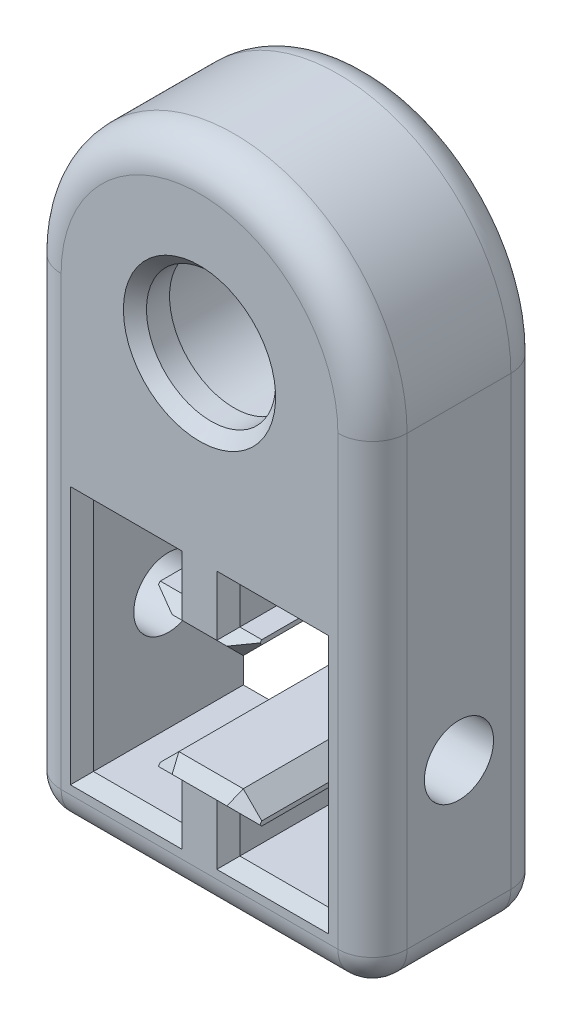
from build123d import *

# Parameters (mm, degrees)
BOSS_EXTRUDE1_DEPTH = 15
SKETCH4_R           = 6.8
BOSS_EXTRUDE2_DEPTH = 15
SKETCH3_R           = 3
CUT_EXTRUDE1_DEPTH  = 54.593283161
FILLET1_R           = 3
SKETCH5_R           = 10
SKETCH5_R_2         = 5.6
BOSS_EXTRUDE3_DEPTH = 3
CHAMFER1_SIZE       = 1


with BuildPart() as part:
    # Sketch1 → Boss-Extrude1 (new body)
    with BuildSketch(Plane.XY):
        Polygon((0, 15), (15, 15), (15, -14.949649214), (-15, -14.949649214), (-15, 15), align=None)
        Polygon((-10.2, 10.2), (-2.5, 10.2), (-2.5, 7), (-4.4, 7), (-4.4, 6.61), (-2.79, 5), (2.79, 5), (4.4, 6.61), (4.4, 7), (2.5, 7), (2.5, 10.2), (10.2, 10.2), (10.2, 3), (10.2, -3), (10.2, -10.2), (2.5, -10.2), (2.5, -7), (4.4, -7), (4.4, -6.61), (2.79, -5), (-2.79, -5), (-4.4, -6.61), (-4.4, -7), (-2.5, -7), (-2.5, -10.2), (-10.2, -10.2), (-10.2, -3), (-10.2, 3), align=None, mode=Mode.SUBTRACT)
    extrude(amount=BOSS_EXTRUDE1_DEPTH)

    # Sketch4 → Boss-Extrude2 (add)
    with BuildSketch(Plane(origin=(0, 0, 0), x_dir=(-1, 0, 0), z_dir=(0, 0, -1))):
        with BuildLine():
            ThreePointArc((-15, 26.8), (0, 41.8), (15, 26.8))
            Line((15, 26.8), (15, 15))
            Line((15, 15), (-15, 15))
            Line((-15, 15), (-15, 26.8))
        make_face()
        with Locations((0, 26.8)):
            Circle(SKETCH4_R, mode=Mode.SUBTRACT)
    extrude(amount=-BOSS_EXTRUDE2_DEPTH)

    # Sketch3 → Cut-Extrude1 (cut, through all)
    with BuildSketch(Plane.ZY.offset(15)):
        with Locations((7.5, 0)):
            Circle(SKETCH3_R)
    extrude(amount=-CUT_EXTRUDE1_DEPTH, mode=Mode.SUBTRACT)

    # Fillet1
    fillet1_edges = [part.edges().sort_by_distance(p)[0] for p in [
        (0, -14.949649214, 15),
        (15, 5.925175393, 15),
        (15, 5.925175393, 0),
        (0, -14.949649214, 0),
        (-15, 5.925175393, 0),
        (-15, 5.925175393, 15),
        (15, -14.949649214, 7.5),
        (-15, -14.949649214, 7.5),
        (0, 41.8, 15),
        (0, 41.8, 0),
    ]]
    fillet(fillet1_edges, radius=FILLET1_R)

    # Sketch5 → Boss-Extrude3 (add)
    with BuildSketch(Plane.XY.offset(15)):
        with Locations((0, 26.8)):
            Circle(SKETCH5_R)
        with Locations((0, 26.8)):
            Circle(SKETCH5_R_2, mode=Mode.SUBTRACT)
    extrude(amount=-BOSS_EXTRUDE3_DEPTH)

    # Chamfer1
    # the kernel refuses this chamfer: 1 mm, written as the material it takes off along each edge
    with BuildSketch(Plane(origin=(0, 26.8, 0), x_dir=(-1, 0, 0), z_dir=(0, -1, 0))) as chamfer1_piece_1:
        Polygon((6.8 + CHAMFER1_SIZE, 0), (6.8, -CHAMFER1_SIZE), (6.8, 0), align=None)
    revolve(axis=Axis((0, 26.8, 0), (0, 0, -1)), mode=Mode.SUBTRACT)
    with BuildSketch(Plane(origin=(-6.21845448, 8.42845448, 0), x_dir=(-0.019442520806012907, -0.01944252080601295, 0.9996219169112968), z_dir=(0.7071067811865483, -0.7071067811865468, 0)), Plane(origin=(0.97154552, 3.18154552, 0), x_dir=(0.019442520806014205, -0.019442520806014246, 0.9996219169112968), z_dir=(0.7071067811865483, 0.7071067811865468, 0)), Plane(origin=(6.21845448, -8.42845448, 0), x_dir=(0.019442520806012883, 0.01944252080601297, 0.9996219169112968), z_dir=(-0.7071067811865491, 0.707106781186546, 0)), Plane(origin=(-0.97154552, -3.18154552, 0), x_dir=(-0.01944252080601413, 0.019442520806014215, 0.9996219169112968), z_dir=(-0.7071067811865491, -0.707106781186546, 0)), Plane(origin=(-0.97154552, -3.18154552, 15), x_dir=(0.7068394360706718, -0.7068394360706751, 0.027495876610585623), z_dir=(-0.7071067811865491, -0.707106781186546, 0)), Plane(origin=(6.21845448, -8.42845448, 15), x_dir=(-0.706839436070672, -0.706839436070675, 0.02749587661058563), z_dir=(-0.7071067811865491, 0.707106781186546, 0)), Plane(origin=(0.97154552, 3.18154552, 15), x_dir=(-0.7068394360706727, 0.7068394360706742, 0.027495876610585623), z_dir=(0.7071067811865483, 0.7071067811865468, 0)), Plane(origin=(-6.21845448, 8.42845448, 15), x_dir=(0.7068394360706728, 0.7068394360706743, 0.027495876610585647), z_dir=(0.7071067811865483, -0.7071067811865468, 0))) as chamfer1_piece_2:
        Polygon((CHAMFER1_SIZE * 0.999621916911, -CHAMFER1_SIZE * 0.0274958766106), (-CHAMFER1_SIZE * 0.0274958766106, -CHAMFER1_SIZE * 0.999621916911), (0, 0), align=None)
    extrude(amount=7.420249811, mode=Mode.SUBTRACT)
    with BuildSketch(Plane(origin=(-5.361682988, 5, 0), x_dir=(0, -0.027495876610586494, 0.9996219169112968), z_dir=(1, 0, 0)), Plane(origin=(5.361682988, -5, 0), x_dir=(0, 0.027495876610586494, 0.9996219169112968), z_dir=(-1, 0, 0)), Plane(origin=(5.361682988, -5, 15), x_dir=(0, -0.9996219169112968, 0.027495876610585623), z_dir=(-1, 0, 0)), Plane(origin=(-5.361682988, 5, 15), x_dir=(0, 0.9996219169112968, 0.027495876610585623), z_dir=(1, 0, 0))) as chamfer1_piece_3:
        Polygon((CHAMFER1_SIZE * 0.999621916911, -CHAMFER1_SIZE * 0.0274958766106), (-CHAMFER1_SIZE * 0.0274958766106, -CHAMFER1_SIZE * 0.999621916911), (0, 0), align=None)
    extrude(amount=10.723365976, mode=Mode.SUBTRACT)
    with BuildSketch(Plane(origin=(6.971682988, 7, 0), x_dir=(0, 0.027495876610586494, 0.9996219169112968), z_dir=(-1, 0, 0)), Plane(origin=(2.5, -7, 0), x_dir=(0, -0.027495876610586494, 0.9996219169112968), z_dir=(1, 0, 0)), Plane(origin=(-6.971682988, -7, 0), x_dir=(0, -0.027495876610586494, 0.9996219169112968), z_dir=(1, 0, 0)), Plane(origin=(-2.5, 7, 0), x_dir=(0, 0.027495876610586494, 0.9996219169112968), z_dir=(-1, 0, 0)), Plane(origin=(-6.971682988, -7, 15), x_dir=(0, 0.9996219169112968, 0.027495876610585623), z_dir=(1, 0, 0)), Plane(origin=(2.5, -7, 15), x_dir=(0, 0.9996219169112968, 0.027495876610585623), z_dir=(1, 0, 0)), Plane(origin=(6.971682988, 7, 15), x_dir=(0, -0.9996219169112968, 0.027495876610585623), z_dir=(-1, 0, 0)), Plane(origin=(-2.5, 7, 15), x_dir=(0, -0.9996219169112968, 0.027495876610585623), z_dir=(-1, 0, 0))) as chamfer1_piece_4:
        Polygon((CHAMFER1_SIZE * 0.999621916911, -CHAMFER1_SIZE * 0.0274958766106), (-CHAMFER1_SIZE * 0.0274958766106, -CHAMFER1_SIZE * 0.999621916911), (0, 0), align=None)
    extrude(amount=4.471682988, mode=Mode.SUBTRACT)
    with BuildSketch(Plane(origin=(2.5, 7, 0), x_dir=(0.027495876610586494, 0, 0.9996219169112968), z_dir=(0, 1, 0)), Plane(origin=(2.5, -10.2, 0), x_dir=(0.027495876610586494, 0, 0.9996219169112968), z_dir=(0, 1, 0)), Plane(origin=(-2.5, -7, 0), x_dir=(-0.027495876610586494, 0, 0.9996219169112968), z_dir=(0, -1, 0)), Plane(origin=(-2.5, 10.2, 0), x_dir=(-0.027495876610586494, 0, 0.9996219169112968), z_dir=(0, -1, 0)), Plane(origin=(-2.5, 10.2, 15), x_dir=(0.9996219169112968, 3.884311438261996e-15, 0.02749587661058563), z_dir=(0, -1, 0)), Plane(origin=(-2.5, -7, 15), x_dir=(0.9996219169112968, -4.161762255280711e-15, 0.02749587661058563), z_dir=(0, -1, 0)), Plane(origin=(2.5, -10.2, 15), x_dir=(-0.9996219169112968, -4.161762255280711e-15, 0.02749587661058563), z_dir=(0, 1, 0)), Plane(origin=(2.5, 7, 15), x_dir=(-0.9996219169112968, 3.606860621243281e-15, 0.02749587661058563), z_dir=(0, 1, 0))) as chamfer1_piece_5:
        Polygon((CHAMFER1_SIZE * 0.999621916911, -CHAMFER1_SIZE * 0.0274958766106), (-CHAMFER1_SIZE * 0.0274958766106, -CHAMFER1_SIZE * 0.999621916911), (0, 0), align=None)
    extrude(amount=3.2, mode=Mode.SUBTRACT)
    with BuildSketch(Plane(origin=(2.5, 10.2, 0), x_dir=(0, -0.02749587661058563, 0.9996219169112968), z_dir=(1, 0, 0)), Plane(origin=(10.2, -10.2, 0), x_dir=(0, 0.02749587661058563, 0.9996219169112968), z_dir=(-1, 0, 0)), Plane(origin=(-2.5, -10.2, 0), x_dir=(0, 0.02749587661058563, 0.9996219169112968), z_dir=(-1, 0, 0)), Plane(origin=(-10.2, 10.2, 0), x_dir=(0, -0.02749587661058563, 0.9996219169112968), z_dir=(1, 0, 0)), Plane(origin=(-10.2, 10.2, 15), x_dir=(0, 0.9996219169112968, 0.027495876610585647), z_dir=(1, 0, 0)), Plane(origin=(-2.5, -10.2, 15), x_dir=(0, -0.9996219169112968, 0.027495876610585647), z_dir=(-1, 0, 0)), Plane(origin=(10.2, -10.2, 15), x_dir=(0, -0.9996219169112968, 0.027495876610585647), z_dir=(-1, 0, 0)), Plane(origin=(2.5, 10.2, 15), x_dir=(0, 0.9996219169112968, 0.027495876610585647), z_dir=(1, 0, 0))) as chamfer1_piece_6:
        Polygon((CHAMFER1_SIZE * 0.999621916911, -CHAMFER1_SIZE * 0.0274958766106), (-CHAMFER1_SIZE * 0.0274958766106, -CHAMFER1_SIZE * 0.999621916911), (0, 0), align=None)
    extrude(amount=7.7, mode=Mode.SUBTRACT)
    with BuildSketch(Plane(origin=(10.2, 10.2, 0), x_dir=(-0.027495876610583895, 0, 0.9996219169112968), z_dir=(0, -1, 0)), Plane(origin=(-10.2, -10.2, 0), x_dir=(0.02749587661058217, 0, 0.9996219169112968), z_dir=(0, 1, 0))) as chamfer1_piece_7:
        Polygon((CHAMFER1_SIZE * 0.999621916911, -CHAMFER1_SIZE * 0.0274958766106), (-CHAMFER1_SIZE * 0.0274958766106, -CHAMFER1_SIZE * 0.999621916911), (0, 0), align=None)
    extrude(amount=20.4, mode=Mode.SUBTRACT)
    with BuildSketch(Plane(origin=(-10.2, 10.2, 15), x_dir=(-0.9996219169112968, 0, 0.027495876610585647), z_dir=(0, -1, 0)), Plane(origin=(10.2, -10.2, 15), x_dir=(0.9996219169112968, 0, 0.027495876610585647), z_dir=(0, 1, 0))) as chamfer1_piece_8:
        Polygon((CHAMFER1_SIZE * 0.999621916911, CHAMFER1_SIZE * 0.0274958766106), (-CHAMFER1_SIZE * 0.0274958766106, CHAMFER1_SIZE * 0.999621916911), (0, 0), align=None)
    extrude(amount=20.4, mode=Mode.SUBTRACT)
    with BuildSketch(Plane(origin=(0, 26.8, 15), x_dir=(1, 0, 0), z_dir=(0, -1, 0))) as chamfer1_piece_9:
        Polygon((5.6 + CHAMFER1_SIZE, 0), (5.6, -CHAMFER1_SIZE), (5.6, 0), align=None)
    revolve(axis=Axis((0, 26.8, 15), (0, 0, 1)), mode=Mode.SUBTRACT)
    with BuildSketch(Plane(origin=(6.971682988, 7, 0), x_dir=(0, 0.027495876610586494, 0.9996219169112968), z_dir=(-1, 0, 0))) as chamfer1_piece_10a_section:
        Polygon((CHAMFER1_SIZE * 0.999621916911, -CHAMFER1_SIZE * 0.0274958766106), (-CHAMFER1_SIZE * 0.0274958766106, -CHAMFER1_SIZE * 0.999621916911), (0, 0), align=None)
    chamfer1_piece_10a = extrude(amount=7.043365976, mode=Mode.PRIVATE)
    chamfer1_piece_10a = split(chamfer1_piece_10a, bisect_by=Plane(origin=(2.5, 6.670206373, 0.329793627), z_dir=(-1, 0, 0)), keep=Keep.TOP, mode=Mode.PRIVATE)
    with BuildSketch(Plane(origin=(2.5, 4.428317012, 0), x_dir=(0.027495876610586494, 0, 0.9996219169112968), z_dir=(0, 1, 0))) as chamfer1_piece_10b_section:
        Polygon((CHAMFER1_SIZE * 0.999621916911, -CHAMFER1_SIZE * 0.0274958766106), (-CHAMFER1_SIZE * 0.0274958766106, -CHAMFER1_SIZE * 0.999621916911), (0, 0), align=None)
    chamfer1_piece_10b = extrude(amount=5.771682988, mode=Mode.PRIVATE)
    chamfer1_piece_10b = split(chamfer1_piece_10b, bisect_by=Plane(origin=(2.170206373, 7, 0.329793627), z_dir=(0, -1, 0)), keep=Keep.TOP, mode=Mode.PRIVATE)
    chamfer1_piece_10 = chamfer1_piece_10a & chamfer1_piece_10b
    add(chamfer1_piece_10, mode=Mode.SUBTRACT)
    with BuildSketch(Plane(origin=(2.5, 7, 0), x_dir=(0.027495876610586494, 0, 0.9996219169112968), z_dir=(0, 1, 0))) as chamfer1_piece_11a_section:
        Polygon((CHAMFER1_SIZE * 0.999621916911, -CHAMFER1_SIZE * 0.0274958766106), (-CHAMFER1_SIZE * 0.0274958766106, -CHAMFER1_SIZE * 0.999621916911), (0, 0), align=None)
    chamfer1_piece_11a = extrude(amount=5.771682988, mode=Mode.PRIVATE)
    chamfer1_piece_11a = split(chamfer1_piece_11a, bisect_by=Plane(origin=(2.170206373, 10.2, 0.329793627), z_dir=(0, 1, 0)), keep=Keep.TOP, mode=Mode.PRIVATE)
    with BuildSketch(Plane(origin=(-0.071682988, 10.2, 0), x_dir=(0, -0.02749587661058563, 0.9996219169112968), z_dir=(1, 0, 0))) as chamfer1_piece_11b_section:
        Polygon((CHAMFER1_SIZE * 0.999621916911, -CHAMFER1_SIZE * 0.0274958766106), (-CHAMFER1_SIZE * 0.0274958766106, -CHAMFER1_SIZE * 0.999621916911), (0, 0), align=None)
    chamfer1_piece_11b = extrude(amount=10.271682988, mode=Mode.PRIVATE)
    chamfer1_piece_11b = split(chamfer1_piece_11b, bisect_by=Plane(origin=(2.5, 10.529793627, 0.329793627), z_dir=(-1, 0, 0)), keep=Keep.TOP, mode=Mode.PRIVATE)
    chamfer1_piece_11 = chamfer1_piece_11a & chamfer1_piece_11b
    add(chamfer1_piece_11, mode=Mode.SUBTRACT)
    with BuildSketch(Plane(origin=(2.5, 10.2, 0), x_dir=(0, -0.02749587661058563, 0.9996219169112968), z_dir=(1, 0, 0))) as chamfer1_piece_12a_section:
        Polygon((CHAMFER1_SIZE * 0.999621916911, -CHAMFER1_SIZE * 0.0274958766106), (-CHAMFER1_SIZE * 0.0274958766106, -CHAMFER1_SIZE * 0.999621916911), (0, 0), align=None)
    chamfer1_piece_12a = extrude(amount=10.271682988, mode=Mode.PRIVATE)
    chamfer1_piece_12a = split(chamfer1_piece_12a, bisect_by=Plane(origin=(10.2, 10.529793627, 0.329793627), z_dir=(1, 0, 0)), keep=Keep.TOP, mode=Mode.PRIVATE)
    with BuildSketch(Plane(origin=(10.2, 12.771682988, 0), x_dir=(-0.02749587661058563, 0, 0.9996219169112968), z_dir=(0, -1, 0))) as chamfer1_piece_12b_section:
        Polygon((CHAMFER1_SIZE * 0.999621916911, -CHAMFER1_SIZE * 0.0274958766106), (-CHAMFER1_SIZE * 0.0274958766106, -CHAMFER1_SIZE * 0.999621916911), (0, 0), align=None)
    chamfer1_piece_12b = extrude(amount=22.971682988, mode=Mode.PRIVATE)
    chamfer1_piece_12b = split(chamfer1_piece_12b, bisect_by=Plane(origin=(10.529793627, 10.2, 0.329793627), z_dir=(0, 1, 0)), keep=Keep.TOP, mode=Mode.PRIVATE)
    chamfer1_piece_12 = chamfer1_piece_12a & chamfer1_piece_12b
    add(chamfer1_piece_12, mode=Mode.SUBTRACT)
    with BuildSketch(Plane(origin=(12.771682988, -10.2, 0), x_dir=(0, 0.02749587661058563, 0.9996219169112968), z_dir=(-1, 0, 0))) as chamfer1_piece_13a_section:
        Polygon((CHAMFER1_SIZE * 0.999621916911, -CHAMFER1_SIZE * 0.0274958766106), (-CHAMFER1_SIZE * 0.0274958766106, -CHAMFER1_SIZE * 0.999621916911), (0, 0), align=None)
    chamfer1_piece_13a = extrude(amount=10.271682988, mode=Mode.PRIVATE)
    chamfer1_piece_13a = split(chamfer1_piece_13a, bisect_by=Plane(origin=(10.2, -10.529793627, 0.329793627), z_dir=(1, 0, 0)), keep=Keep.TOP, mode=Mode.PRIVATE)
    with BuildSketch(Plane(origin=(10.2, 10.2, 0), x_dir=(-0.027495876610583895, 0, 0.9996219169112968), z_dir=(0, -1, 0))) as chamfer1_piece_13b_section:
        Polygon((CHAMFER1_SIZE * 0.999621916911, -CHAMFER1_SIZE * 0.0274958766106), (-CHAMFER1_SIZE * 0.0274958766106, -CHAMFER1_SIZE * 0.999621916911), (0, 0), align=None)
    chamfer1_piece_13b = extrude(amount=22.971682988, mode=Mode.PRIVATE)
    chamfer1_piece_13b = split(chamfer1_piece_13b, bisect_by=Plane(origin=(10.529793627, -10.2, 0.329793627), z_dir=(0, -1, 0)), keep=Keep.TOP, mode=Mode.PRIVATE)
    chamfer1_piece_13 = chamfer1_piece_13a & chamfer1_piece_13b
    add(chamfer1_piece_13, mode=Mode.SUBTRACT)
    with BuildSketch(Plane(origin=(2.5, -12.771682988, 0), x_dir=(0.027495876610586494, 0, 0.9996219169112968), z_dir=(0, 1, 0))) as chamfer1_piece_14a_section:
        Polygon((CHAMFER1_SIZE * 0.999621916911, -CHAMFER1_SIZE * 0.0274958766106), (-CHAMFER1_SIZE * 0.0274958766106, -CHAMFER1_SIZE * 0.999621916911), (0, 0), align=None)
    chamfer1_piece_14a = extrude(amount=5.771682988, mode=Mode.PRIVATE)
    chamfer1_piece_14a = split(chamfer1_piece_14a, bisect_by=Plane(origin=(2.170206373, -10.2, 0.329793627), z_dir=(0, -1, 0)), keep=Keep.TOP, mode=Mode.PRIVATE)
    with BuildSketch(Plane(origin=(10.2, -10.2, 0), x_dir=(0, 0.02749587661058563, 0.9996219169112968), z_dir=(-1, 0, 0))) as chamfer1_piece_14b_section:
        Polygon((CHAMFER1_SIZE * 0.999621916911, -CHAMFER1_SIZE * 0.0274958766106), (-CHAMFER1_SIZE * 0.0274958766106, -CHAMFER1_SIZE * 0.999621916911), (0, 0), align=None)
    chamfer1_piece_14b = extrude(amount=10.271682988, mode=Mode.PRIVATE)
    chamfer1_piece_14b = split(chamfer1_piece_14b, bisect_by=Plane(origin=(2.5, -10.529793627, 0.329793627), z_dir=(-1, 0, 0)), keep=Keep.TOP, mode=Mode.PRIVATE)
    chamfer1_piece_14 = chamfer1_piece_14a & chamfer1_piece_14b
    add(chamfer1_piece_14, mode=Mode.SUBTRACT)
    with BuildSketch(Plane(origin=(-0.071682988, -7, 0), x_dir=(0, -0.027495876610586494, 0.9996219169112968), z_dir=(1, 0, 0))) as chamfer1_piece_15a_section:
        Polygon((CHAMFER1_SIZE * 0.999621916911, -CHAMFER1_SIZE * 0.0274958766106), (-CHAMFER1_SIZE * 0.0274958766106, -CHAMFER1_SIZE * 0.999621916911), (0, 0), align=None)
    chamfer1_piece_15a = extrude(amount=7.043365976, mode=Mode.PRIVATE)
    chamfer1_piece_15a = split(chamfer1_piece_15a, bisect_by=Plane(origin=(2.5, -6.670206373, 0.329793627), z_dir=(-1, 0, 0)), keep=Keep.TOP, mode=Mode.PRIVATE)
    with BuildSketch(Plane(origin=(2.5, -10.2, 0), x_dir=(0.027495876610586494, 0, 0.9996219169112968), z_dir=(0, 1, 0))) as chamfer1_piece_15b_section:
        Polygon((CHAMFER1_SIZE * 0.999621916911, -CHAMFER1_SIZE * 0.0274958766106), (-CHAMFER1_SIZE * 0.0274958766106, -CHAMFER1_SIZE * 0.999621916911), (0, 0), align=None)
    chamfer1_piece_15b = extrude(amount=5.771682988, mode=Mode.PRIVATE)
    chamfer1_piece_15b = split(chamfer1_piece_15b, bisect_by=Plane(origin=(2.170206373, -7, 0.329793627), z_dir=(0, 1, 0)), keep=Keep.TOP, mode=Mode.PRIVATE)
    chamfer1_piece_15 = chamfer1_piece_15a & chamfer1_piece_15b
    add(chamfer1_piece_15, mode=Mode.SUBTRACT)
    with BuildSketch(Plane(origin=(-2.5, -4.428317012, 0), x_dir=(-0.027495876610586494, 0, 0.9996219169112968), z_dir=(0, -1, 0))) as chamfer1_piece_16a_section:
        Polygon((CHAMFER1_SIZE * 0.999621916911, -CHAMFER1_SIZE * 0.0274958766106), (-CHAMFER1_SIZE * 0.0274958766106, -CHAMFER1_SIZE * 0.999621916911), (0, 0), align=None)
    chamfer1_piece_16a = extrude(amount=5.771682988, mode=Mode.PRIVATE)
    chamfer1_piece_16a = split(chamfer1_piece_16a, bisect_by=Plane(origin=(-2.170206373, -7, 0.329793627), z_dir=(0, 1, 0)), keep=Keep.TOP, mode=Mode.PRIVATE)
    with BuildSketch(Plane(origin=(-6.971682988, -7, 0), x_dir=(0, -0.027495876610586494, 0.9996219169112968), z_dir=(1, 0, 0))) as chamfer1_piece_16b_section:
        Polygon((CHAMFER1_SIZE * 0.999621916911, -CHAMFER1_SIZE * 0.0274958766106), (-CHAMFER1_SIZE * 0.0274958766106, -CHAMFER1_SIZE * 0.999621916911), (0, 0), align=None)
    chamfer1_piece_16b = extrude(amount=7.043365976, mode=Mode.PRIVATE)
    chamfer1_piece_16b = split(chamfer1_piece_16b, bisect_by=Plane(origin=(-2.5, -6.670206373, 0.329793627), z_dir=(1, 0, 0)), keep=Keep.TOP, mode=Mode.PRIVATE)
    chamfer1_piece_16 = chamfer1_piece_16a & chamfer1_piece_16b
    add(chamfer1_piece_16, mode=Mode.SUBTRACT)
    with BuildSketch(Plane(origin=(0.071682988, -10.2, 0), x_dir=(0, 0.02749587661058563, 0.9996219169112968), z_dir=(-1, 0, 0))) as chamfer1_piece_17a_section:
        Polygon((CHAMFER1_SIZE * 0.999621916911, -CHAMFER1_SIZE * 0.0274958766106), (-CHAMFER1_SIZE * 0.0274958766106, -CHAMFER1_SIZE * 0.999621916911), (0, 0), align=None)
    chamfer1_piece_17a = extrude(amount=10.271682988, mode=Mode.PRIVATE)
    chamfer1_piece_17a = split(chamfer1_piece_17a, bisect_by=Plane(origin=(-2.5, -10.529793627, 0.329793627), z_dir=(1, 0, 0)), keep=Keep.TOP, mode=Mode.PRIVATE)
    with BuildSketch(Plane(origin=(-2.5, -7, 0), x_dir=(-0.027495876610586494, 0, 0.9996219169112968), z_dir=(0, -1, 0))) as chamfer1_piece_17b_section:
        Polygon((CHAMFER1_SIZE * 0.999621916911, -CHAMFER1_SIZE * 0.0274958766106), (-CHAMFER1_SIZE * 0.0274958766106, -CHAMFER1_SIZE * 0.999621916911), (0, 0), align=None)
    chamfer1_piece_17b = extrude(amount=5.771682988, mode=Mode.PRIVATE)
    chamfer1_piece_17b = split(chamfer1_piece_17b, bisect_by=Plane(origin=(-2.170206373, -10.2, 0.329793627), z_dir=(0, -1, 0)), keep=Keep.TOP, mode=Mode.PRIVATE)
    chamfer1_piece_17 = chamfer1_piece_17a & chamfer1_piece_17b
    add(chamfer1_piece_17, mode=Mode.SUBTRACT)
    with BuildSketch(Plane(origin=(-10.2, -12.771682988, 0), x_dir=(0.02749587661058563, 0, 0.9996219169112968), z_dir=(0, 1, 0))) as chamfer1_piece_18a_section:
        Polygon((CHAMFER1_SIZE * 0.999621916911, -CHAMFER1_SIZE * 0.0274958766106), (-CHAMFER1_SIZE * 0.0274958766106, -CHAMFER1_SIZE * 0.999621916911), (0, 0), align=None)
    chamfer1_piece_18a = extrude(amount=22.971682988, mode=Mode.PRIVATE)
    chamfer1_piece_18a = split(chamfer1_piece_18a, bisect_by=Plane(origin=(-10.529793627, -10.2, 0.329793627), z_dir=(0, -1, 0)), keep=Keep.TOP, mode=Mode.PRIVATE)
    with BuildSketch(Plane(origin=(-2.5, -10.2, 0), x_dir=(0, 0.02749587661058563, 0.9996219169112968), z_dir=(-1, 0, 0))) as chamfer1_piece_18b_section:
        Polygon((CHAMFER1_SIZE * 0.999621916911, -CHAMFER1_SIZE * 0.0274958766106), (-CHAMFER1_SIZE * 0.0274958766106, -CHAMFER1_SIZE * 0.999621916911), (0, 0), align=None)
    chamfer1_piece_18b = extrude(amount=10.271682988, mode=Mode.PRIVATE)
    chamfer1_piece_18b = split(chamfer1_piece_18b, bisect_by=Plane(origin=(-10.2, -10.529793627, 0.329793627), z_dir=(-1, 0, 0)), keep=Keep.TOP, mode=Mode.PRIVATE)
    chamfer1_piece_18 = chamfer1_piece_18a & chamfer1_piece_18b
    add(chamfer1_piece_18, mode=Mode.SUBTRACT)
    with BuildSketch(Plane(origin=(-10.2, -10.2, 0), x_dir=(0.02749587661058217, 0, 0.9996219169112968), z_dir=(0, 1, 0))) as chamfer1_piece_19a_section:
        Polygon((CHAMFER1_SIZE * 0.999621916911, -CHAMFER1_SIZE * 0.0274958766106), (-CHAMFER1_SIZE * 0.0274958766106, -CHAMFER1_SIZE * 0.999621916911), (0, 0), align=None)
    chamfer1_piece_19a = extrude(amount=22.971682988, mode=Mode.PRIVATE)
    chamfer1_piece_19a = split(chamfer1_piece_19a, bisect_by=Plane(origin=(-10.529793627, 10.2, 0.329793627), z_dir=(0, 1, 0)), keep=Keep.TOP, mode=Mode.PRIVATE)
    with BuildSketch(Plane(origin=(-12.771682988, 10.2, 0), x_dir=(0, -0.02749587661058563, 0.9996219169112968), z_dir=(1, 0, 0))) as chamfer1_piece_19b_section:
        Polygon((CHAMFER1_SIZE * 0.999621916911, -CHAMFER1_SIZE * 0.0274958766106), (-CHAMFER1_SIZE * 0.0274958766106, -CHAMFER1_SIZE * 0.999621916911), (0, 0), align=None)
    chamfer1_piece_19b = extrude(amount=10.271682988, mode=Mode.PRIVATE)
    chamfer1_piece_19b = split(chamfer1_piece_19b, bisect_by=Plane(origin=(-10.2, 10.529793627, 0.329793627), z_dir=(-1, 0, 0)), keep=Keep.TOP, mode=Mode.PRIVATE)
    chamfer1_piece_19 = chamfer1_piece_19a & chamfer1_piece_19b
    add(chamfer1_piece_19, mode=Mode.SUBTRACT)
    with BuildSketch(Plane(origin=(-10.2, 10.2, 0), x_dir=(0, -0.02749587661058563, 0.9996219169112968), z_dir=(1, 0, 0))) as chamfer1_piece_20a_section:
        Polygon((CHAMFER1_SIZE * 0.999621916911, -CHAMFER1_SIZE * 0.0274958766106), (-CHAMFER1_SIZE * 0.0274958766106, -CHAMFER1_SIZE * 0.999621916911), (0, 0), align=None)
    chamfer1_piece_20a = extrude(amount=10.271682988, mode=Mode.PRIVATE)
    chamfer1_piece_20a = split(chamfer1_piece_20a, bisect_by=Plane(origin=(-2.5, 10.529793627, 0.329793627), z_dir=(1, 0, 0)), keep=Keep.TOP, mode=Mode.PRIVATE)
    with BuildSketch(Plane(origin=(-2.5, 12.771682988, 0), x_dir=(-0.027495876610586494, 0, 0.9996219169112968), z_dir=(0, -1, 0))) as chamfer1_piece_20b_section:
        Polygon((CHAMFER1_SIZE * 0.999621916911, -CHAMFER1_SIZE * 0.0274958766106), (-CHAMFER1_SIZE * 0.0274958766106, -CHAMFER1_SIZE * 0.999621916911), (0, 0), align=None)
    chamfer1_piece_20b = extrude(amount=5.771682988, mode=Mode.PRIVATE)
    chamfer1_piece_20b = split(chamfer1_piece_20b, bisect_by=Plane(origin=(-2.170206373, 10.2, 0.329793627), z_dir=(0, 1, 0)), keep=Keep.TOP, mode=Mode.PRIVATE)
    chamfer1_piece_20 = chamfer1_piece_20a & chamfer1_piece_20b
    add(chamfer1_piece_20, mode=Mode.SUBTRACT)
    with BuildSketch(Plane(origin=(-2.5, 10.2, 0), x_dir=(-0.027495876610586494, 0, 0.9996219169112968), z_dir=(0, -1, 0))) as chamfer1_piece_21a_section:
        Polygon((CHAMFER1_SIZE * 0.999621916911, -CHAMFER1_SIZE * 0.0274958766106), (-CHAMFER1_SIZE * 0.0274958766106, -CHAMFER1_SIZE * 0.999621916911), (0, 0), align=None)
    chamfer1_piece_21a = extrude(amount=5.771682988, mode=Mode.PRIVATE)
    chamfer1_piece_21a = split(chamfer1_piece_21a, bisect_by=Plane(origin=(-2.170206373, 7, 0.329793627), z_dir=(0, -1, 0)), keep=Keep.TOP, mode=Mode.PRIVATE)
    with BuildSketch(Plane(origin=(0.071682988, 7, 0), x_dir=(0, 0.027495876610586494, 0.9996219169112968), z_dir=(-1, 0, 0))) as chamfer1_piece_21b_section:
        Polygon((CHAMFER1_SIZE * 0.999621916911, -CHAMFER1_SIZE * 0.0274958766106), (-CHAMFER1_SIZE * 0.0274958766106, -CHAMFER1_SIZE * 0.999621916911), (0, 0), align=None)
    chamfer1_piece_21b = extrude(amount=7.043365976, mode=Mode.PRIVATE)
    chamfer1_piece_21b = split(chamfer1_piece_21b, bisect_by=Plane(origin=(-2.5, 6.670206373, 0.329793627), z_dir=(1, 0, 0)), keep=Keep.TOP, mode=Mode.PRIVATE)
    chamfer1_piece_21 = chamfer1_piece_21a & chamfer1_piece_21b
    add(chamfer1_piece_21, mode=Mode.SUBTRACT)
    with BuildSketch(Plane(origin=(-2.5, 12.771682988, 15), x_dir=(0.9996219169112968, 3.884311438261996e-15, 0.02749587661058563), z_dir=(0, -1, 0))) as chamfer1_piece_22a_section:
        Polygon((CHAMFER1_SIZE * 0.999621916911, -CHAMFER1_SIZE * 0.0274958766106), (-CHAMFER1_SIZE * 0.0274958766106, -CHAMFER1_SIZE * 0.999621916911), (0, 0), align=None)
    chamfer1_piece_22a = extrude(amount=5.771682988, mode=Mode.PRIVATE)
    chamfer1_piece_22a = split(chamfer1_piece_22a, bisect_by=Plane(origin=(-2.170206373, 10.2, 14.670206373), z_dir=(0, 1, 0)), keep=Keep.TOP, mode=Mode.PRIVATE)
    with BuildSketch(Plane(origin=(-10.2, 10.2, 15), x_dir=(0, 0.9996219169112968, 0.027495876610585647), z_dir=(1, 0, 0))) as chamfer1_piece_22b_section:
        Polygon((CHAMFER1_SIZE * 0.999621916911, -CHAMFER1_SIZE * 0.0274958766106), (-CHAMFER1_SIZE * 0.0274958766106, -CHAMFER1_SIZE * 0.999621916911), (0, 0), align=None)
    chamfer1_piece_22b = extrude(amount=10.271682988, mode=Mode.PRIVATE)
    chamfer1_piece_22b = split(chamfer1_piece_22b, bisect_by=Plane(origin=(-2.5, 10.529793627, 14.670206373), z_dir=(1, 0, 0)), keep=Keep.TOP, mode=Mode.PRIVATE)
    chamfer1_piece_22 = chamfer1_piece_22a & chamfer1_piece_22b
    add(chamfer1_piece_22, mode=Mode.SUBTRACT)
    with BuildSketch(Plane(origin=(0.071682988, 7, 15), x_dir=(0, -0.9996219169112968, 0.027495876610585623), z_dir=(-1, 0, 0))) as chamfer1_piece_23a_section:
        Polygon((CHAMFER1_SIZE * 0.999621916911, -CHAMFER1_SIZE * 0.0274958766106), (-CHAMFER1_SIZE * 0.0274958766106, -CHAMFER1_SIZE * 0.999621916911), (0, 0), align=None)
    chamfer1_piece_23a = extrude(amount=7.043365976, mode=Mode.PRIVATE)
    chamfer1_piece_23a = split(chamfer1_piece_23a, bisect_by=Plane(origin=(-2.5, 6.670206373, 14.670206373), z_dir=(1, 0, 0)), keep=Keep.TOP, mode=Mode.PRIVATE)
    with BuildSketch(Plane(origin=(-2.5, 10.2, 15), x_dir=(0.9996219169112968, 3.884311438261996e-15, 0.02749587661058563), z_dir=(0, -1, 0))) as chamfer1_piece_23b_section:
        Polygon((CHAMFER1_SIZE * 0.999621916911, -CHAMFER1_SIZE * 0.0274958766106), (-CHAMFER1_SIZE * 0.0274958766106, -CHAMFER1_SIZE * 0.999621916911), (0, 0), align=None)
    chamfer1_piece_23b = extrude(amount=5.771682988, mode=Mode.PRIVATE)
    chamfer1_piece_23b = split(chamfer1_piece_23b, bisect_by=Plane(origin=(-2.170206373, 7, 14.670206373), z_dir=(0, -1, 0)), keep=Keep.TOP, mode=Mode.PRIVATE)
    chamfer1_piece_23 = chamfer1_piece_23a & chamfer1_piece_23b
    add(chamfer1_piece_23, mode=Mode.SUBTRACT)
    with BuildSketch(Plane(origin=(-10.2, 12.771682988, 15), x_dir=(-0.9996219169112968, 0, 0.027495876610585647), z_dir=(0, -1, 0))) as chamfer1_piece_24a_section:
        Polygon((CHAMFER1_SIZE * 0.999621916911, CHAMFER1_SIZE * 0.0274958766106), (-CHAMFER1_SIZE * 0.0274958766106, CHAMFER1_SIZE * 0.999621916911), (0, 0), align=None)
    chamfer1_piece_24a = extrude(amount=22.971682988, mode=Mode.PRIVATE)
    chamfer1_piece_24a = split(chamfer1_piece_24a, bisect_by=Plane(origin=(-10.529793627, 10.2, 14.670206373), z_dir=(0, 1, 0)), keep=Keep.TOP, mode=Mode.PRIVATE)
    with BuildSketch(Plane(origin=(-12.771682988, 10.2, 15), x_dir=(0, 0.9996219169112968, 0.027495876610585647), z_dir=(1, 0, 0))) as chamfer1_piece_24b_section:
        Polygon((CHAMFER1_SIZE * 0.999621916911, -CHAMFER1_SIZE * 0.0274958766106), (-CHAMFER1_SIZE * 0.0274958766106, -CHAMFER1_SIZE * 0.999621916911), (0, 0), align=None)
    chamfer1_piece_24b = extrude(amount=10.271682988, mode=Mode.PRIVATE)
    chamfer1_piece_24b = split(chamfer1_piece_24b, bisect_by=Plane(origin=(-10.2, 10.529793627, 14.670206373), z_dir=(-1, 0, 0)), keep=Keep.TOP, mode=Mode.PRIVATE)
    chamfer1_piece_24 = chamfer1_piece_24a & chamfer1_piece_24b
    add(chamfer1_piece_24, mode=Mode.SUBTRACT)
    with BuildSketch(Plane(origin=(-10.2, 10.2, 15), x_dir=(-0.9996219169112968, 0, 0.027495876610585647), z_dir=(0, -1, 0))) as chamfer1_piece_25a_section:
        Polygon((CHAMFER1_SIZE * 0.999621916911, CHAMFER1_SIZE * 0.0274958766106), (-CHAMFER1_SIZE * 0.0274958766106, CHAMFER1_SIZE * 0.999621916911), (0, 0), align=None)
    chamfer1_piece_25a = extrude(amount=22.971682988, mode=Mode.PRIVATE)
    chamfer1_piece_25a = split(chamfer1_piece_25a, bisect_by=Plane(origin=(-10.529793627, -10.2, 14.670206373), z_dir=(0, -1, 0)), keep=Keep.TOP, mode=Mode.PRIVATE)
    with BuildSketch(Plane(origin=(-2.5, -10.2, 15), x_dir=(0, -0.9996219169112968, 0.027495876610585647), z_dir=(-1, 0, 0))) as chamfer1_piece_25b_section:
        Polygon((CHAMFER1_SIZE * 0.999621916911, -CHAMFER1_SIZE * 0.0274958766106), (-CHAMFER1_SIZE * 0.0274958766106, -CHAMFER1_SIZE * 0.999621916911), (0, 0), align=None)
    chamfer1_piece_25b = extrude(amount=10.271682988, mode=Mode.PRIVATE)
    chamfer1_piece_25b = split(chamfer1_piece_25b, bisect_by=Plane(origin=(-10.2, -10.529793627, 14.670206373), z_dir=(-1, 0, 0)), keep=Keep.TOP, mode=Mode.PRIVATE)
    chamfer1_piece_25 = chamfer1_piece_25a & chamfer1_piece_25b
    add(chamfer1_piece_25, mode=Mode.SUBTRACT)
    with BuildSketch(Plane(origin=(0.071682988, -10.2, 15), x_dir=(0, -0.9996219169112968, 0.027495876610585647), z_dir=(-1, 0, 0))) as chamfer1_piece_26a_section:
        Polygon((CHAMFER1_SIZE * 0.999621916911, -CHAMFER1_SIZE * 0.0274958766106), (-CHAMFER1_SIZE * 0.0274958766106, -CHAMFER1_SIZE * 0.999621916911), (0, 0), align=None)
    chamfer1_piece_26a = extrude(amount=10.271682988, mode=Mode.PRIVATE)
    chamfer1_piece_26a = split(chamfer1_piece_26a, bisect_by=Plane(origin=(-2.5, -10.529793627, 14.670206373), z_dir=(1, 0, 0)), keep=Keep.TOP, mode=Mode.PRIVATE)
    with BuildSketch(Plane(origin=(-2.5, -7, 15), x_dir=(0.9996219169112968, -4.161762255280711e-15, 0.02749587661058563), z_dir=(0, -1, 0))) as chamfer1_piece_26b_section:
        Polygon((CHAMFER1_SIZE * 0.999621916911, -CHAMFER1_SIZE * 0.0274958766106), (-CHAMFER1_SIZE * 0.0274958766106, -CHAMFER1_SIZE * 0.999621916911), (0, 0), align=None)
    chamfer1_piece_26b = extrude(amount=5.771682988, mode=Mode.PRIVATE)
    chamfer1_piece_26b = split(chamfer1_piece_26b, bisect_by=Plane(origin=(-2.170206373, -10.2, 14.670206373), z_dir=(0, -1, 0)), keep=Keep.TOP, mode=Mode.PRIVATE)
    chamfer1_piece_26 = chamfer1_piece_26a & chamfer1_piece_26b
    add(chamfer1_piece_26, mode=Mode.SUBTRACT)
    with BuildSketch(Plane(origin=(-2.5, -4.428317012, 15), x_dir=(0.9996219169112968, -4.161762255280711e-15, 0.02749587661058563), z_dir=(0, -1, 0))) as chamfer1_piece_27a_section:
        Polygon((CHAMFER1_SIZE * 0.999621916911, -CHAMFER1_SIZE * 0.0274958766106), (-CHAMFER1_SIZE * 0.0274958766106, -CHAMFER1_SIZE * 0.999621916911), (0, 0), align=None)
    chamfer1_piece_27a = extrude(amount=5.771682988, mode=Mode.PRIVATE)
    chamfer1_piece_27a = split(chamfer1_piece_27a, bisect_by=Plane(origin=(-2.170206373, -7, 14.670206373), z_dir=(0, 1, 0)), keep=Keep.TOP, mode=Mode.PRIVATE)
    with BuildSketch(Plane(origin=(-6.971682988, -7, 15), x_dir=(0, 0.9996219169112968, 0.027495876610585623), z_dir=(1, 0, 0))) as chamfer1_piece_27b_section:
        Polygon((CHAMFER1_SIZE * 0.999621916911, -CHAMFER1_SIZE * 0.0274958766106), (-CHAMFER1_SIZE * 0.0274958766106, -CHAMFER1_SIZE * 0.999621916911), (0, 0), align=None)
    chamfer1_piece_27b = extrude(amount=7.043365976, mode=Mode.PRIVATE)
    chamfer1_piece_27b = split(chamfer1_piece_27b, bisect_by=Plane(origin=(-2.5, -6.670206373, 14.670206373), z_dir=(1, 0, 0)), keep=Keep.TOP, mode=Mode.PRIVATE)
    chamfer1_piece_27 = chamfer1_piece_27a & chamfer1_piece_27b
    add(chamfer1_piece_27, mode=Mode.SUBTRACT)
    with BuildSketch(Plane(origin=(-0.071682988, -7, 15), x_dir=(0, 0.9996219169112968, 0.027495876610585623), z_dir=(1, 0, 0))) as chamfer1_piece_28a_section:
        Polygon((CHAMFER1_SIZE * 0.999621916911, -CHAMFER1_SIZE * 0.0274958766106), (-CHAMFER1_SIZE * 0.0274958766106, -CHAMFER1_SIZE * 0.999621916911), (0, 0), align=None)
    chamfer1_piece_28a = extrude(amount=7.043365976, mode=Mode.PRIVATE)
    chamfer1_piece_28a = split(chamfer1_piece_28a, bisect_by=Plane(origin=(2.5, -6.670206373, 14.670206373), z_dir=(-1, 0, 0)), keep=Keep.TOP, mode=Mode.PRIVATE)
    with BuildSketch(Plane(origin=(2.5, -10.2, 15), x_dir=(-0.9996219169112968, -4.161762255280711e-15, 0.02749587661058563), z_dir=(0, 1, 0))) as chamfer1_piece_28b_section:
        Polygon((CHAMFER1_SIZE * 0.999621916911, -CHAMFER1_SIZE * 0.0274958766106), (-CHAMFER1_SIZE * 0.0274958766106, -CHAMFER1_SIZE * 0.999621916911), (0, 0), align=None)
    chamfer1_piece_28b = extrude(amount=5.771682988, mode=Mode.PRIVATE)
    chamfer1_piece_28b = split(chamfer1_piece_28b, bisect_by=Plane(origin=(2.170206373, -7, 14.670206373), z_dir=(0, 1, 0)), keep=Keep.TOP, mode=Mode.PRIVATE)
    chamfer1_piece_28 = chamfer1_piece_28a & chamfer1_piece_28b
    add(chamfer1_piece_28, mode=Mode.SUBTRACT)
    with BuildSketch(Plane(origin=(2.5, -12.771682988, 15), x_dir=(-0.9996219169112968, -4.161762255280711e-15, 0.02749587661058563), z_dir=(0, 1, 0))) as chamfer1_piece_29a_section:
        Polygon((CHAMFER1_SIZE * 0.999621916911, -CHAMFER1_SIZE * 0.0274958766106), (-CHAMFER1_SIZE * 0.0274958766106, -CHAMFER1_SIZE * 0.999621916911), (0, 0), align=None)
    chamfer1_piece_29a = extrude(amount=5.771682988, mode=Mode.PRIVATE)
    chamfer1_piece_29a = split(chamfer1_piece_29a, bisect_by=Plane(origin=(2.170206373, -10.2, 14.670206373), z_dir=(0, -1, 0)), keep=Keep.TOP, mode=Mode.PRIVATE)
    with BuildSketch(Plane(origin=(10.2, -10.2, 15), x_dir=(0, -0.9996219169112968, 0.027495876610585647), z_dir=(-1, 0, 0))) as chamfer1_piece_29b_section:
        Polygon((CHAMFER1_SIZE * 0.999621916911, -CHAMFER1_SIZE * 0.0274958766106), (-CHAMFER1_SIZE * 0.0274958766106, -CHAMFER1_SIZE * 0.999621916911), (0, 0), align=None)
    chamfer1_piece_29b = extrude(amount=10.271682988, mode=Mode.PRIVATE)
    chamfer1_piece_29b = split(chamfer1_piece_29b, bisect_by=Plane(origin=(2.5, -10.529793627, 14.670206373), z_dir=(-1, 0, 0)), keep=Keep.TOP, mode=Mode.PRIVATE)
    chamfer1_piece_29 = chamfer1_piece_29a & chamfer1_piece_29b
    add(chamfer1_piece_29, mode=Mode.SUBTRACT)
    with BuildSketch(Plane(origin=(12.771682988, -10.2, 15), x_dir=(0, -0.9996219169112968, 0.027495876610585647), z_dir=(-1, 0, 0))) as chamfer1_piece_30a_section:
        Polygon((CHAMFER1_SIZE * 0.999621916911, -CHAMFER1_SIZE * 0.0274958766106), (-CHAMFER1_SIZE * 0.0274958766106, -CHAMFER1_SIZE * 0.999621916911), (0, 0), align=None)
    chamfer1_piece_30a = extrude(amount=10.271682988, mode=Mode.PRIVATE)
    chamfer1_piece_30a = split(chamfer1_piece_30a, bisect_by=Plane(origin=(10.2, -10.529793627, 14.670206373), z_dir=(1, 0, 0)), keep=Keep.TOP, mode=Mode.PRIVATE)
    with BuildSketch(Plane(origin=(10.2, -12.771682988, 15), x_dir=(0.9996219169112968, 0, 0.027495876610585647), z_dir=(0, 1, 0))) as chamfer1_piece_30b_section:
        Polygon((CHAMFER1_SIZE * 0.999621916911, CHAMFER1_SIZE * 0.0274958766106), (-CHAMFER1_SIZE * 0.0274958766106, CHAMFER1_SIZE * 0.999621916911), (0, 0), align=None)
    chamfer1_piece_30b = extrude(amount=22.971682988, mode=Mode.PRIVATE)
    chamfer1_piece_30b = split(chamfer1_piece_30b, bisect_by=Plane(origin=(10.529793627, -10.2, 14.670206373), z_dir=(0, -1, 0)), keep=Keep.TOP, mode=Mode.PRIVATE)
    chamfer1_piece_30 = chamfer1_piece_30a & chamfer1_piece_30b
    add(chamfer1_piece_30, mode=Mode.SUBTRACT)
    with BuildSketch(Plane(origin=(10.2, -10.2, 15), x_dir=(0.9996219169112968, 0, 0.027495876610585647), z_dir=(0, 1, 0))) as chamfer1_piece_31a_section:
        Polygon((CHAMFER1_SIZE * 0.999621916911, CHAMFER1_SIZE * 0.0274958766106), (-CHAMFER1_SIZE * 0.0274958766106, CHAMFER1_SIZE * 0.999621916911), (0, 0), align=None)
    chamfer1_piece_31a = extrude(amount=22.971682988, mode=Mode.PRIVATE)
    chamfer1_piece_31a = split(chamfer1_piece_31a, bisect_by=Plane(origin=(10.529793627, 10.2, 14.670206373), z_dir=(0, 1, 0)), keep=Keep.TOP, mode=Mode.PRIVATE)
    with BuildSketch(Plane(origin=(2.5, 10.2, 15), x_dir=(0, 0.9996219169112968, 0.027495876610585647), z_dir=(1, 0, 0))) as chamfer1_piece_31b_section:
        Polygon((CHAMFER1_SIZE * 0.999621916911, -CHAMFER1_SIZE * 0.0274958766106), (-CHAMFER1_SIZE * 0.0274958766106, -CHAMFER1_SIZE * 0.999621916911), (0, 0), align=None)
    chamfer1_piece_31b = extrude(amount=10.271682988, mode=Mode.PRIVATE)
    chamfer1_piece_31b = split(chamfer1_piece_31b, bisect_by=Plane(origin=(10.2, 10.529793627, 14.670206373), z_dir=(1, 0, 0)), keep=Keep.TOP, mode=Mode.PRIVATE)
    chamfer1_piece_31 = chamfer1_piece_31a & chamfer1_piece_31b
    add(chamfer1_piece_31, mode=Mode.SUBTRACT)
    with BuildSketch(Plane(origin=(-0.071682988, 10.2, 15), x_dir=(0, 0.9996219169112968, 0.027495876610585647), z_dir=(1, 0, 0))) as chamfer1_piece_32a_section:
        Polygon((CHAMFER1_SIZE * 0.999621916911, -CHAMFER1_SIZE * 0.0274958766106), (-CHAMFER1_SIZE * 0.0274958766106, -CHAMFER1_SIZE * 0.999621916911), (0, 0), align=None)
    chamfer1_piece_32a = extrude(amount=10.271682988, mode=Mode.PRIVATE)
    chamfer1_piece_32a = split(chamfer1_piece_32a, bisect_by=Plane(origin=(2.5, 10.529793627, 14.670206373), z_dir=(-1, 0, 0)), keep=Keep.TOP, mode=Mode.PRIVATE)
    with BuildSketch(Plane(origin=(2.5, 7, 15), x_dir=(-0.9996219169112968, 3.606860621243281e-15, 0.02749587661058563), z_dir=(0, 1, 0))) as chamfer1_piece_32b_section:
        Polygon((CHAMFER1_SIZE * 0.999621916911, -CHAMFER1_SIZE * 0.0274958766106), (-CHAMFER1_SIZE * 0.0274958766106, -CHAMFER1_SIZE * 0.999621916911), (0, 0), align=None)
    chamfer1_piece_32b = extrude(amount=5.771682988, mode=Mode.PRIVATE)
    chamfer1_piece_32b = split(chamfer1_piece_32b, bisect_by=Plane(origin=(2.170206373, 10.2, 14.670206373), z_dir=(0, 1, 0)), keep=Keep.TOP, mode=Mode.PRIVATE)
    chamfer1_piece_32 = chamfer1_piece_32a & chamfer1_piece_32b
    add(chamfer1_piece_32, mode=Mode.SUBTRACT)
    with BuildSketch(Plane(origin=(2.5, 4.428317012, 15), x_dir=(-0.9996219169112968, 3.606860621243281e-15, 0.02749587661058563), z_dir=(0, 1, 0))) as chamfer1_piece_33a_section:
        Polygon((CHAMFER1_SIZE * 0.999621916911, -CHAMFER1_SIZE * 0.0274958766106), (-CHAMFER1_SIZE * 0.0274958766106, -CHAMFER1_SIZE * 0.999621916911), (0, 0), align=None)
    chamfer1_piece_33a = extrude(amount=5.771682988, mode=Mode.PRIVATE)
    chamfer1_piece_33a = split(chamfer1_piece_33a, bisect_by=Plane(origin=(2.170206373, 7, 14.670206373), z_dir=(0, -1, 0)), keep=Keep.TOP, mode=Mode.PRIVATE)
    with BuildSketch(Plane(origin=(6.971682988, 7, 15), x_dir=(0, -0.9996219169112968, 0.027495876610585623), z_dir=(-1, 0, 0))) as chamfer1_piece_33b_section:
        Polygon((CHAMFER1_SIZE * 0.999621916911, -CHAMFER1_SIZE * 0.0274958766106), (-CHAMFER1_SIZE * 0.0274958766106, -CHAMFER1_SIZE * 0.999621916911), (0, 0), align=None)
    chamfer1_piece_33b = extrude(amount=7.043365976, mode=Mode.PRIVATE)
    chamfer1_piece_33b = split(chamfer1_piece_33b, bisect_by=Plane(origin=(2.5, 6.670206373, 14.670206373), z_dir=(-1, 0, 0)), keep=Keep.TOP, mode=Mode.PRIVATE)
    chamfer1_piece_33 = chamfer1_piece_33a & chamfer1_piece_33b
    add(chamfer1_piece_33, mode=Mode.SUBTRACT)


solid = part.part
